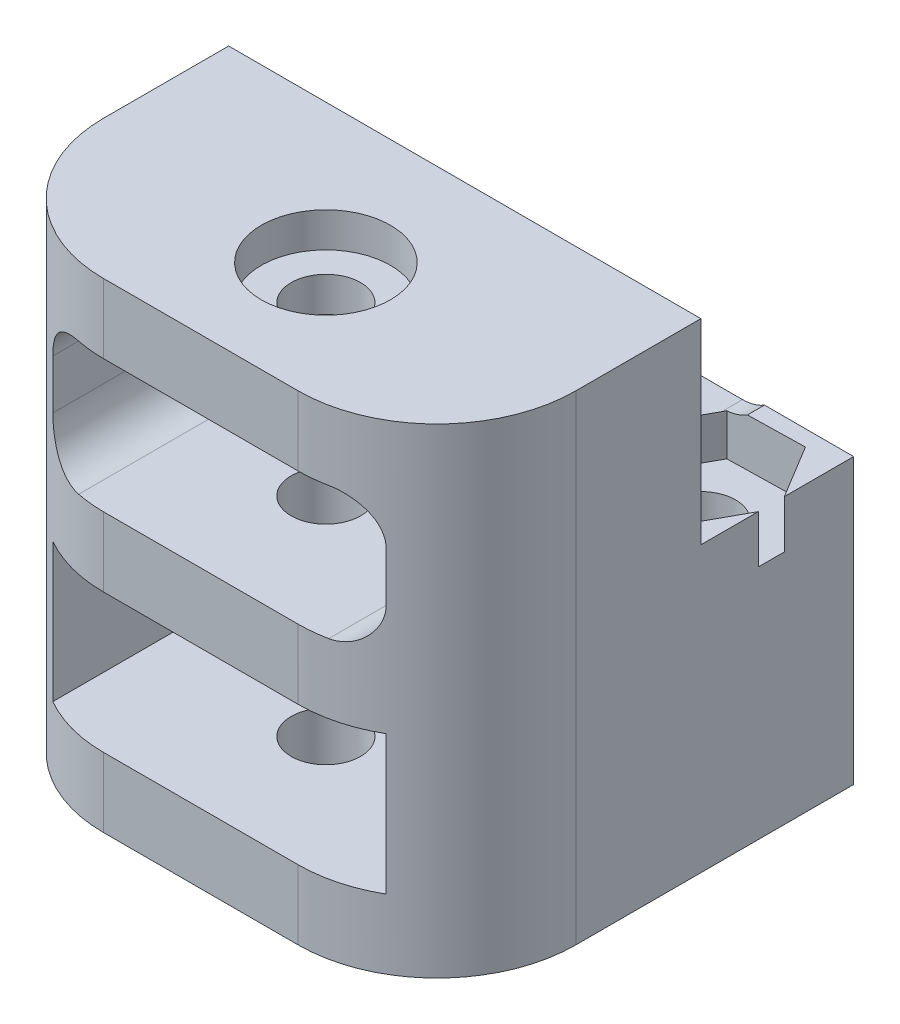
from build123d import *
from build123d.topology import SkipClean

# Parameters (mm, degrees)
CROQUIS1_W                = 5
CROQUIS1_H                = 30
SALIENTE_EXTRUIR1_DEPTH   = 19.1
SALIENTE_EXTRUIR1_2_DEPTH = 19.1
CROQUIS2_W                = 30
CROQUIS2_H                = 5
CROQUIS2_H_2              = 20
SALIENTE_EXTRUIR2_DEPTH   = 24
CORTAR_EXTRUIR1_REACH     = 56.173
CROQUIS3_R                = 2.5
CROQUIS4_R                = 4.65
CORTAR_EXTRUIR2_DEPTH     = 2.5
REDONDEO1_R               = 10
CORTAR_EXTRUIR8_REACH     = 48.271
CROQUIS12_R               = 2.5
REDONDEO2_DEPTH           = 29.797959071
REDONDEO2_START           = 4.55
REDONDEO2_2_DEPTH         = 6.55
REDONDEO2_START_2         = 7.549995607
REDONDEO2_3_DEPTH         = 6.550004393
CORTAR_EXTRUIR10_DEPTH    = 3
CROQUIS15_W               = 11
CROQUIS15_H               = 6
CORTAR_EXTRUIR11_DEPTH    = 34
CORTAR_EXTRUIR14_REACH    = 48.271
CROQUIS17_R               = 2.5
CROQUIS18_W               = 11
CROQUIS18_H               = 8.1
CORTAR_EXTRUIR15_DEPTH    = 34
SALIENTE_EXTRUIR3_REACH   = 56.173
CORTAR_EXTRUIR16_REACH    = 47.889
CROQUIS20_W               = 24
CROQUIS20_H               = 10


with BuildPart() as part:
    # Croquis1 → Saliente-Extruir1 (new body)
    with BuildSketch(Plane(origin=(0, 0, 0), x_dir=(1, 0, 0), z_dir=(0, 1, 0))):
        with Locations((2.5, -15)):
            Rectangle(CROQUIS1_W, CROQUIS1_H)
    extrude(amount=SALIENTE_EXTRUIR1_DEPTH)



with BuildPart() as body_2:
    # Croquis1 → Saliente-Extruir1 2 (new body)
    with BuildSketch(Plane(origin=(0, 0, 0), x_dir=(1, 0, 0), z_dir=(0, 1, 0))):
        with Locations((-26.5, -15)):
            Rectangle(CROQUIS1_W, CROQUIS1_H)
    extrude(amount=SALIENTE_EXTRUIR1_2_DEPTH)


with BuildPart() as part_1:
    add(part.part)

    add(body_2.part)  # Saliente-Extruir2 merges body 2
    # Croquis2 → Saliente-Extruir2 (add)
    with BuildSketch(Plane.ZY):
        with Locations((15, 16.6)):
            Rectangle(CROQUIS2_W, CROQUIS2_H)
        with Locations((15, -5.45)):
            Rectangle(CROQUIS2_W, CROQUIS2_H_2)
    extrude(amount=SALIENTE_EXTRUIR2_DEPTH)

    # Croquis3 → Cortar-Extruir1 (cut, up to next)
    with BuildSketch(Plane(origin=(0, 19.1, 0), x_dir=(1, 0, 0), z_dir=(0, 1, 0)), mode=Mode.PRIVATE) as cortar_extruir1_sk1:
        with Locations(Location((-12, -21, 0), (0, 0, 270))):
            Circle(CROQUIS3_R)
    cortar_extruir1_tool1 = extrude(cortar_extruir1_sk1.sketch, amount=-CORTAR_EXTRUIR1_REACH, mode=Mode.PRIVATE) & part_1.part
    add(cortar_extruir1_tool1.solids().sort_by_distance((-12, 19.1, 21))[0], mode=Mode.SUBTRACT)

    # Croquis4 → Cortar-Extruir2 (cut)
    with BuildSketch(Plane(origin=(0, 19.1, 0), x_dir=(1, 0, 0), z_dir=(0, 1, 0))):
        with Locations(Location((-12, -21, 0), (0, 0, 270))):
            Circle(CROQUIS4_R)
    extrude(amount=-CORTAR_EXTRUIR2_DEPTH, mode=Mode.SUBTRACT)

    # Redondeo1
    # the kernel refuses this fillet: 10 mm, written as the material it takes off along each edge
    with BuildSketch(Plane(origin=(-29, -25, 30), x_dir=(1, 0, 0), z_dir=(0, 1, 0)), Plane(origin=(5, -25, 30), x_dir=(0, 0, -1), z_dir=(0, 1, 0))) as redondeo1_piece_1:
        with BuildLine():
            CenterArc((REDONDEO1_R, REDONDEO1_R), REDONDEO1_R, 180, 90)
            Line((0, REDONDEO1_R), (0, 0))
            Line((0, 0), (REDONDEO1_R, 0))
        make_face()
    extrude(amount=69.1, mode=Mode.SUBTRACT)

    # Cortar-Extruir8: up to this face of the body (flat: up to its plane)
    cortar_extruir8_end = Plane(part_1.part.faces().sort_by_distance((-12, -15.45, 14.911465184))[0])
    # Croquis12 → Cortar-Extruir8 (cut, up to the picked face)
    with BuildSketch(Plane(origin=(0, 4.55, 0), x_dir=(1, 0, 0), z_dir=(0, 1, 0)), mode=Mode.PRIVATE) as cortar_extruir8_sk1:
        with Locations(Location((-24, -6, 0), (0, 0, 270))):
            Circle(CROQUIS12_R)
    cortar_extruir8_tool1 = split(extrude(cortar_extruir8_sk1.sketch, amount=-CORTAR_EXTRUIR8_REACH, mode=Mode.PRIVATE), bisect_by=cortar_extruir8_end, keep=Keep.BOTH, mode=Mode.PRIVATE)
    # Croquis12 → Cortar-Extruir8 (cut, up to the picked face)
    with BuildSketch(Plane(origin=(0, 4.55, 0), x_dir=(1, 0, 0), z_dir=(0, 1, 0)), mode=Mode.PRIVATE) as cortar_extruir8_sk2:
        with Locations(Location((0, -6, 0), (0, 0, 270))):
            Circle(CROQUIS12_R)
    cortar_extruir8_tool2 = split(extrude(cortar_extruir8_sk2.sketch, amount=-CORTAR_EXTRUIR8_REACH, mode=Mode.PRIVATE), bisect_by=cortar_extruir8_end, keep=Keep.BOTH, mode=Mode.PRIVATE)
    add(cortar_extruir8_tool1.solids().sort_by(Axis((-24, 4.55, 6), (0, -1, 0)))[0], mode=Mode.SUBTRACT)
    add(cortar_extruir8_tool2.solids().sort_by(Axis((0, 4.55, 6), (0, -1, 0)))[0], mode=Mode.SUBTRACT)

    # Redondeo2: read off the stored shape, not the designer's step
    # Redondeo2 outline → Redondeo2 (add)
    with BuildSketch(Plane.XY):
        with BuildLine():
            Line((-24, 14.1), (-24, 11.1))
            ThreePointArc((-24, 11.1), (-23.121320344, 13.221320344), (-21, 14.1))
            Line((-21, 14.1), (-24, 14.1))
        make_face()
        with BuildLine():
            ThreePointArc((-21, 4.55), (-23.121320344, 5.428679656), (-24, 7.55))
            Line((-24, 7.55), (-24, 4.55))
            Line((-24, 4.55), (-21, 4.55))
        make_face()
        with BuildLine():
            Line((0, 14.1), (-3, 14.1))
            ThreePointArc((-3, 14.1), (-0.878679656, 13.221320344), (0, 11.1))
            Line((0, 11.1), (0, 14.1))
        make_face()
        with BuildLine():
            ThreePointArc((0, 7.55), (-0.878679656, 5.428679656), (-3, 4.55))
            Line((-3, 4.55), (0, 4.55))
            Line((0, 4.55), (0, 7.55))
        make_face()
    extrude(amount=REDONDEO2_DEPTH)

    # Redondeo2 2 outline → Redondeo2 2 (cut)
    with BuildSketch(Plane(origin=(0, 0, 0), x_dir=(1, 0, 0), z_dir=(0, 1, 0)).offset(REDONDEO2_START)):
        with BuildLine():
            ThreePointArc((-24, -8.5), (-21.5, -6), (-24, -3.5))
            Line((-24, -3.5), (-24, -8.5))
        make_face()
        with BuildLine():
            ThreePointArc((-20.99999998, -29.797958975), (-22.545926263, -29.350208925), (-24, -28.660254038))
            Line((-24, -28.660254038), (-24, -29.797959071))
            Line((-24, -29.797959071), (-20.99999998, -29.797958975))
        make_face()
        with BuildLine():
            Line((0, -29.797959071), (0, -28.660254038))
            ThreePointArc((0, -28.660254038), (-1.454073737, -29.350208925), (-3.00000002, -29.797958975))
            Line((-3.00000002, -29.797958975), (0, -29.797959071))
        make_face()
        with BuildLine():
            Line((0, -8.5), (0, -3.5))
            ThreePointArc((0, -3.5), (-2.5, -6), (0, -8.5))
        make_face()
    extrude(amount=REDONDEO2_2_DEPTH, mode=Mode.SUBTRACT)

    # Redondeo2 3 outline → Redondeo2 3 (cut)
    with BuildSketch(Plane(origin=(0, 0, 0), x_dir=(1, 0, 0), z_dir=(0, 1, 0)).offset(REDONDEO2_START_2)):
        with BuildLine():
            ThreePointArc((-20.99999998, -29.797958975), (-22.545926263, -29.350208925), (-24, -28.660254038))
            Line((-24, -28.660254038), (-24, -29.797959071))
            Line((-24, -29.797959071), (-20.99999998, -29.797958975))
        make_face()
        with BuildLine():
            Line((0, -29.797959071), (0, -28.660254038))
            ThreePointArc((0, -28.660254038), (-1.454073737, -29.350208925), (-3.00000002, -29.797958975))
            Line((-3.00000002, -29.797958975), (0, -29.797959071))
        make_face()
    extrude(amount=REDONDEO2_3_DEPTH, mode=Mode.SUBTRACT)

    # Croquis14 → Cortar-Extruir10 (cut, symmetric)
    with SkipClean():  # the faces are left unmerged after this step: merging them gives an invalid solid
        with BuildSketch(Plane(origin=(0, 4.55, 0), x_dir=(1, 0, 0), z_dir=(0, 1, 0))):
            Polygon((-5.541319679, -6.117372146), (-2.669012579, -10.857609685), (2.872307099, -10.740237539), (5.541319679, -5.882627854), (2.669012579, -1.142390315), (-2.872307099, -1.259762461), align=None)
            Polygon((-18.457437416, -6), (-21.228718708, -1.2), (-26.771281292, -1.2), (-29.542562584, -6), (-26.771281292, -10.8), (-21.228718708, -10.8), align=None)
        extrude(amount=CORTAR_EXTRUIR10_DEPTH, both=True, mode=Mode.SUBTRACT)

    # Croquis15 → Cortar-Extruir11 (cut)
    with BuildSketch(Plane(origin=(5, 0, 0), x_dir=(0, 0, -1), z_dir=(1, 0, 0))):
        with Locations((-5.5, 8)):
            Rectangle(CROQUIS15_W, CROQUIS15_H)
    extrude(amount=-CORTAR_EXTRUIR11_DEPTH, mode=Mode.SUBTRACT)

    # Croquis17 → Cortar-Extruir14 (cut, up to next)
    with BuildSketch(Plane(origin=(0, 4.55, 0), x_dir=(1, 0, 0), z_dir=(0, 1, 0)), mode=Mode.PRIVATE) as cortar_extruir14_sk1:
        with Locations(Location((-12, -21, 0), (0, 0, 270))):
            Circle(CROQUIS17_R)
    cortar_extruir14_tool1 = extrude(cortar_extruir14_sk1.sketch, amount=-CORTAR_EXTRUIR14_REACH, mode=Mode.PRIVATE) & part_1.part
    add(cortar_extruir14_tool1.solids().sort_by_distance((-12, 4.55, 21))[0], mode=Mode.SUBTRACT)

    # Croquis18 → Cortar-Extruir15 (cut)
    with BuildSketch(Plane(origin=(5, 0, 0), x_dir=(0, 0, -1), z_dir=(1, 0, 0))):
        with Locations((-5.5, 15.05)):
            Rectangle(CROQUIS18_W, CROQUIS18_H)
    extrude(amount=-CORTAR_EXTRUIR15_DEPTH, mode=Mode.SUBTRACT)

    # Croquis19 → Saliente-Extruir3 (add, up to next)
    with BuildSketch(Plane(origin=(0, -15.45, 0), x_dir=(-1, 0, 0), z_dir=(0, -1, 0)), mode=Mode.PRIVATE) as saliente_extruir3_sk1:
        with BuildLine():
            Line((0, -28.660254038), (0, -8.5))
            ThreePointArc((0, -8.5), (-2.5, -6), (0, -3.5))
            Line((0, -3.5), (0, 0))
            Line((0, 0), (-5, 0))
            Line((-5, 0), (-5, -20))
            ThreePointArc((-5, -20), (-3.660254038, -25), (0, -28.660254038))
        make_face()
    saliente_extruir3_tool1 = extrude(saliente_extruir3_sk1.sketch, amount=-SALIENTE_EXTRUIR3_REACH, mode=Mode.PRIVATE) - part_1.part
    # Croquis19 → Saliente-Extruir3 (add, up to next)
    with BuildSketch(Plane(origin=(0, -15.45, 0), x_dir=(-1, 0, 0), z_dir=(0, -1, 0)), mode=Mode.PRIVATE) as saliente_extruir3_sk2:
        with BuildLine():
            Line((24, -8.5), (24, -28.660254038))
            ThreePointArc((24, -28.660254038), (27.660254038, -25), (29, -20))
            Line((29, -20), (29, 0))
            Line((29, 0), (24, 0))
            Line((24, 0), (24, -3.5))
            ThreePointArc((24, -3.5), (26.5, -6), (24, -8.5))
        make_face()
    saliente_extruir3_tool2 = extrude(saliente_extruir3_sk2.sketch, amount=-SALIENTE_EXTRUIR3_REACH, mode=Mode.PRIVATE) - part_1.part
    add(saliente_extruir3_tool1.solids().sort_by_distance((2.502598, -15.45, 13.726714))[0])
    add(saliente_extruir3_tool2.solids().sort_by_distance((-26.502598, -15.45, 13.726714))[0])

    # Croquis20 → Cortar-Extruir16 (cut, up to next)
    with BuildSketch(Plane(origin=(0, 0, 0), x_dir=(-1, 0, 0), z_dir=(0, 0, -1)), mode=Mode.PRIVATE) as cortar_extruir16_sk1:
        with Locations((12, -5.45)):
            Rectangle(CROQUIS20_W, CROQUIS20_H)
    cortar_extruir16_tool1 = extrude(cortar_extruir16_sk1.sketch, amount=-CORTAR_EXTRUIR16_REACH, mode=Mode.PRIVATE) & part_1.part
    add(cortar_extruir16_tool1.solids().sort_by_distance((-12, -5.45, 0))[0], mode=Mode.SUBTRACT)


solid = part_1.part
